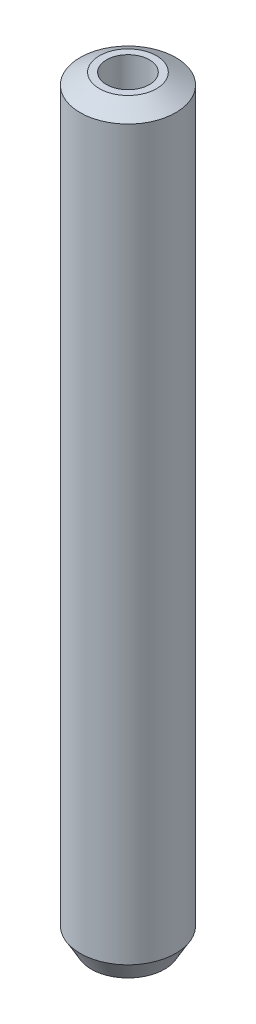
from build123d import *
from OCP.BRepFilletAPI import BRepFilletAPI_MakeChamfer

# Parameters (mm, degrees)
SKETCH1_R           = 17.5
BOSS_EXTRUDE1_DEPTH = 277.563198729
SKETCH2_R           = 7.860107859
CUT_EXTRUDE1_DEPTH  = 279.664366736
CHAMFER1_SIZE       = 4.072001135
CHAMFER1_SIZE2      = 7.052912854


with BuildPart() as part:
    # Sketch1 → Boss-Extrude1 (new body)
    with BuildSketch(Plane(origin=(0, 0, 0), x_dir=(1, 0, 0), z_dir=(0, 1, 0))):
        Circle(SKETCH1_R)
    extrude(amount=BOSS_EXTRUDE1_DEPTH)

    # Sketch2 → Cut-Extrude1 (cut, through all)
    with BuildSketch(Plane(origin=(0, 0, 0), x_dir=(1, 0, 0), z_dir=(0, 1, 0))):
        Circle(SKETCH2_R)
    extrude(amount=CUT_EXTRUDE1_DEPTH, mode=Mode.SUBTRACT)

    # Chamfer1: one chamfer whose edges measure the first distance from different faces: ONE call of the kernel's chamfer builder (chamfer() names one face for all edges)
    chamfer1_edges_1 = [part.edges().sort_by_distance(p)[0] for p in [
        (-17.5, 277.563198729, 0),
    ]]
    chamfer1_side_1 = [part.faces().sort_by_distance(p)[0] for p in [
        (-17.5, 138.781599364, 0),
    ]]
    chamfer1_edges_2 = [part.edges().sort_by_distance(p)[0] for p in [
        (-17.5, 0, 0),
    ]]
    chamfer1_side_2 = [part.faces().sort_by_distance(p)[0] for p in [
        (-17.005025253, 0, 0),
    ]]
    chamfer1 = BRepFilletAPI_MakeChamfer(part.part.solid().wrapped)
    for e in chamfer1_edges_1:
        chamfer1.Add(CHAMFER1_SIZE, CHAMFER1_SIZE2, e.wrapped, chamfer1_side_1[0].wrapped)  # the first distance lies on this face
    for e in chamfer1_edges_2:
        chamfer1.Add(CHAMFER1_SIZE, CHAMFER1_SIZE2, e.wrapped, chamfer1_side_2[0].wrapped)  # the first distance lies on this face
    add(Compound.cast(chamfer1.Shape()), mode=Mode.REPLACE)


solid = part.part
